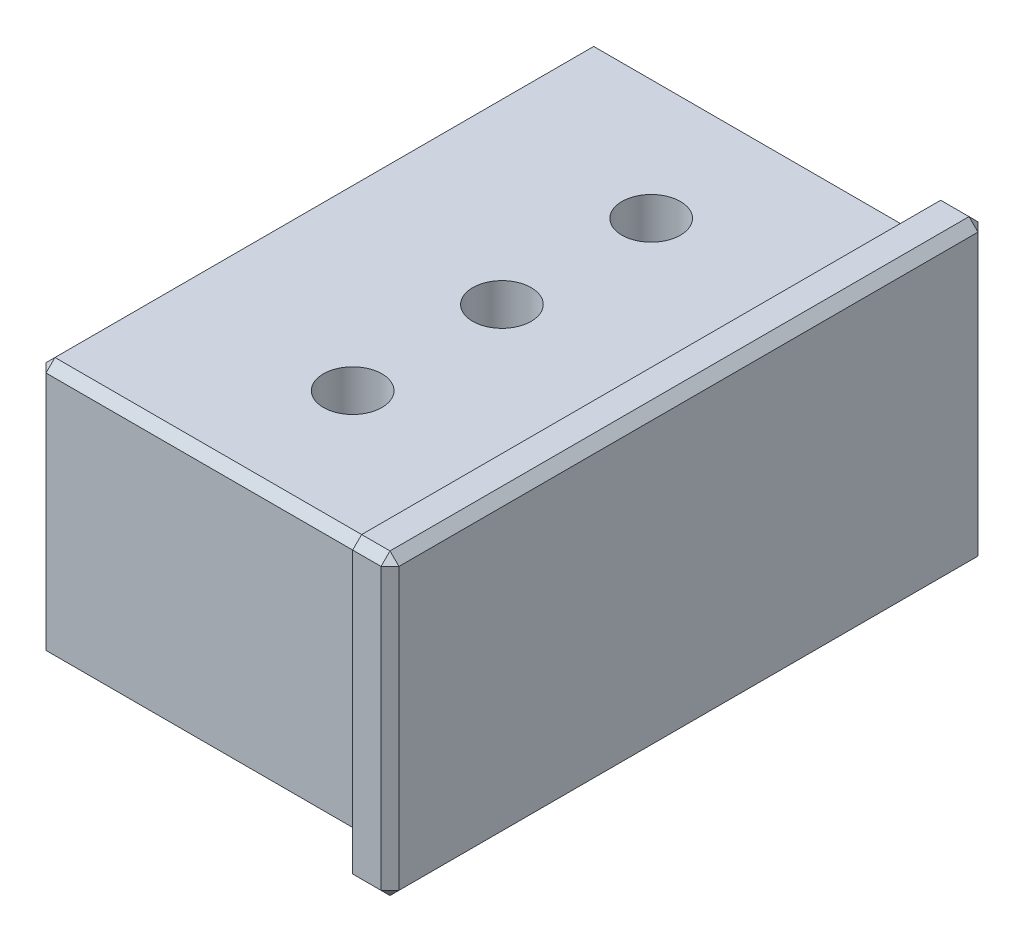
from build123d import *

# Parameters (mm, degrees)
SKETCH1_W           = 47.371
SKETCH1_H           = 21.971
BOSS_EXTRUDE1_DEPTH = 28.575
SKETCH2_W           = 50.8
SKETCH2_H           = 25.4
BOSS_EXTRUDE2_DEPTH = 3.175
CHAMFER1_SIZE       = 0.762
SKETCH3_R           = 2.4892
CUT_EXTRUDE1_DEPTH  = 64.074969049


with BuildPart() as part:
    # Sketch1 → Boss-Extrude1 (new body)
    with BuildSketch(Plane(origin=(0, 0, 0), x_dir=(0, 0, -1), z_dir=(1, 0, 0))):
        with Locations((23.6855, 10.9855)):
            Rectangle(SKETCH1_W, SKETCH1_H)
    extrude(amount=BOSS_EXTRUDE1_DEPTH)

    # Sketch2 → Boss-Extrude2 (add)
    with BuildSketch(Plane(origin=(28.575, 0, 0), x_dir=(0, 0, -1), z_dir=(1, 0, 0))):
        with Locations((23.6855, 10.9855)):
            Rectangle(SKETCH2_W, SKETCH2_H)
    extrude(amount=BOSS_EXTRUDE2_DEPTH)

    # Chamfer1
    chamfer1_edges = [part.edges().sort_by_distance(p)[0] for p in [
        (31.75, 23.6855, -23.6855),
        (30.1625, 23.6855, -49.0855),
        (31.75, 10.9855, -49.0855),
        (30.1625, -1.7145, -49.0855),
        (31.75, -1.7145, -23.6855),
        (30.1625, -1.7145, 1.7145),
        (31.75, 10.9855, 1.7145),
        (30.1625, 23.6855, 1.7145),
        (0, 0, -23.6855),
        (14.2875, 0, -47.371),
        (0, 10.9855, -47.371),
        (14.2875, 21.971, -47.371),
        (0, 21.971, -23.6855),
        (14.2875, 21.971, 0),
        (0, 10.9855, 0),
        (14.2875, 0, 0),
    ]]
    chamfer(chamfer1_edges, length=CHAMFER1_SIZE)

    # Sketch3 → Cut-Extrude1 (cut, through all)
    with BuildSketch(Plane(origin=(0, 21.971, 0), x_dir=(1, 0, 0), z_dir=(0, 1, 0))):
        with Locations((15.875, 23.6855)):
            Circle(SKETCH3_R)
        with Locations((15.875, 36.3855)):
            Circle(SKETCH3_R)
        with Locations((15.875, 10.9855)):
            Circle(SKETCH3_R)
    extrude(amount=-CUT_EXTRUDE1_DEPTH, mode=Mode.SUBTRACT)


solid = part.part
